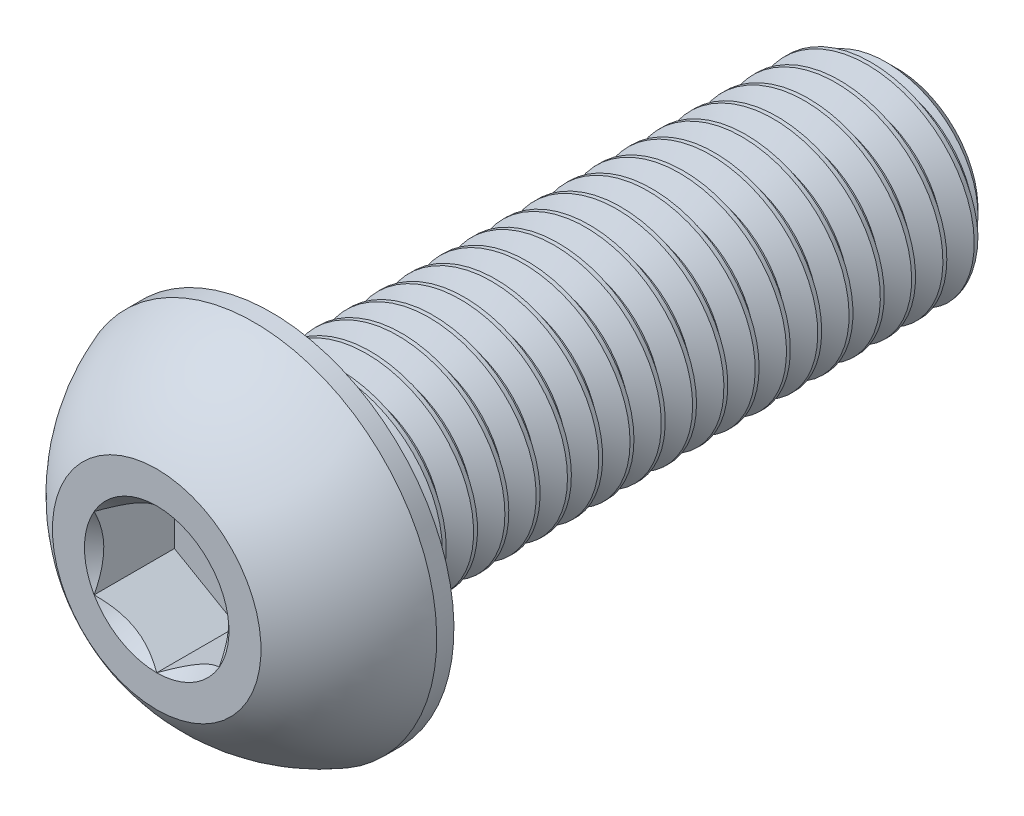
from build123d import *

# Parameters (mm, degrees)
CUT_EXTRUDE2_DEPTH = 3.85
CUT_SWEEP2_PITCH   = 1.5
CUT_SWEEP2_TO      = 30


with BuildPart() as part:
    # Sketch10 → Revolve3 (revolve)
    with BuildSketch(Plane(origin=(0, 0, 0), x_dir=(0, 0, -1), z_dir=(1, 0, 0)), mode=Mode.PRIVATE) as revolve3_sk:
        Polygon((13.875, 5), (15, 3.875), (15, 0), (-15, 0), (-15, 5), align=None)
    revolve(revolve3_sk.sketch.rotate(Axis((0, 0, 20.5), (0, 0, -1)), 180), axis=Axis((0, 0, 20.5), (0, 0, -1)))

    # Sketch7 → Revolve2 (revolve)
    with BuildSketch(Plane(origin=(0, 0, 0), x_dir=(0, 0, -1), z_dir=(1, 0, 0)), mode=Mode.PRIVATE) as revolve2_sk:
        with BuildLine():
            Line((-15.825, 8.75), (-15, 8.75))
            Line((-15, 8.75), (-15, 0))
            Line((-15, 0), (-20.5, 0))
            Line((-20.5, 0), (-20.5, 5))
            ThreePointArc((-20.5, 5), (-18.472534968, 7.26151026), (-15.825, 8.75))
        make_face()
    revolve(revolve2_sk.sketch.rotate(Axis((0, 0, 20.5), (0, 0, -1)), 180), axis=Axis((0, 0, 20.5), (0, 0, -1)))

    # Sketch5 → Cut-Extrude2 (cut)
    with BuildSketch(Plane.XY.offset(20.5)):
        Polygon((3, -1.732050808), (3, 1.732050808), (0, 3.464101615), (-3, 1.732050808), (-3, -1.732050808), (0, -3.464101615), align=None)
    extrude(amount=-CUT_EXTRUDE2_DEPTH, mode=Mode.SUBTRACT)

    # Cut-Extrude3 cone 1 section (through the dimple's axis) → Cut-Extrude3 (revolve, cut)
    with BuildSketch(Plane(origin=(0, 0, 20.5), x_dir=(0, -1, 0), z_dir=(1, 0, 0))):
        Polygon((0, 0), (3.464101615, 0), (0, 3.464101615), align=None)
    revolve(axis=Axis((0, 0, 20.5), (0, 0, -1)), mode=Mode.SUBTRACT)


with BuildPart() as body_2:
    # Split1: read off the stored shape, not the designer's step
    # Split1: the piece on the far side of the plane
    add(part.part)
    split(bisect_by=Plane.XY.offset(15), keep=Keep.BOTTOM)

    # Cut-Sweep2: arcs per turn and ends read off the stored shape
    # Cut-Sweep2: the profile of Sketch12 screwed along a right-hand helix through 25 turns, 8 arcs to a turn; built about Z, then put on its axis
    cut_sweep2_z = Axis((0, 0, 0), (0, 0, 1))
    cut_sweep2_corners = [(4.025721421, 0, -0.5625), (4.025721421, 0, -0.75), (5.081189882, 0, -1.359375), (5.081189882, 0, 0.046875)]
    with BuildLine(mode=Mode.PRIVATE) as cut_sweep2_profile:
        Line(cut_sweep2_corners[0], cut_sweep2_corners[1])
        Line(cut_sweep2_corners[1], cut_sweep2_corners[2])
        Line(cut_sweep2_corners[2], cut_sweep2_corners[3])
        Line(cut_sweep2_corners[3], cut_sweep2_corners[0])
    cut_sweep2_cap = Face(cut_sweep2_profile.wire())
    cut_sweep2_turn_angles = [0, 22.5, 45, 67.5, 90, 112.5, 135, 157.5, 180, 202.5, 225, 247.5, 270, 292.5, 315, 337.5, 360]
    cut_sweep2_turn_weights = [1, 0.9238795325112867, 1, 0.9238795325112867, 1, 0.9238795325112867, 1, 0.9238795325112867, 1, 0.9238795325112867, 1, 0.9238795325112867, 1, 0.9238795325112867, 1, 0.9238795325112867, 1]
    cut_sweep2_turn_rails = [Edge.make_bspline([Vector(p[0], p[1], 0).rotate(cut_sweep2_z, cut_sweep2_turn_angles[k]) / cut_sweep2_turn_weights[k] + Vector(0, 0, p[2] + CUT_SWEEP2_PITCH * cut_sweep2_turn_angles[k] / 360) for k in range(17)], [0, 0, 0, 1, 1, 2, 2, 3, 3, 4, 4, 5, 5, 6, 6, 7, 7, 8, 8, 8], 2, cut_sweep2_turn_weights) for p in cut_sweep2_corners]
    cut_sweep2_turn_sides = [Face.make_surface_from_curves(cut_sweep2_turn_rails[p[0]], cut_sweep2_turn_rails[p[1]]) for p in [(0, 1), (1, 2), (2, 3), (3, 0)]]
    cut_sweep2 = Plane(origin=(0, 0, -15), x_dir=(0, 1, 0), z_dir=(0, 0, 1)) * split(Solid(Shell([*[p.moved(Location((0, 0, CUT_SWEEP2_PITCH * i))) for i in range(25) for p in cut_sweep2_turn_sides], cut_sweep2_cap, cut_sweep2_cap.rotate(cut_sweep2_z, 9000).moved(Location((0, 0, CUT_SWEEP2_PITCH * 9000 / 360)))])), bisect_by=Plane.XY.offset(CUT_SWEEP2_TO), keep=Keep.BOTTOM, mode=Mode.PRIVATE)
    add(cut_sweep2, mode=Mode.SUBTRACT)


with BuildPart() as part_1:
    add(part.part)

    # Split1
    split(bisect_by=Plane.XY.offset(15), keep=Keep.TOP)

    add(body_2.part)  # Boss-Extrude1 merges body 2
    # Boss-Extrude1: read off the stored shape, not the designer's step
    # Boss-Extrude1 outline → Boss-Extrude1 (revolve)
    with BuildSketch(Plane.XZ):
        Polygon((4.025721421, 15), (4.025721421, 14.025721421), (5, 15), align=None)
    revolve(axis=Axis((0, 0, 0), (0, 0, 1)))


solid = part_1.part
